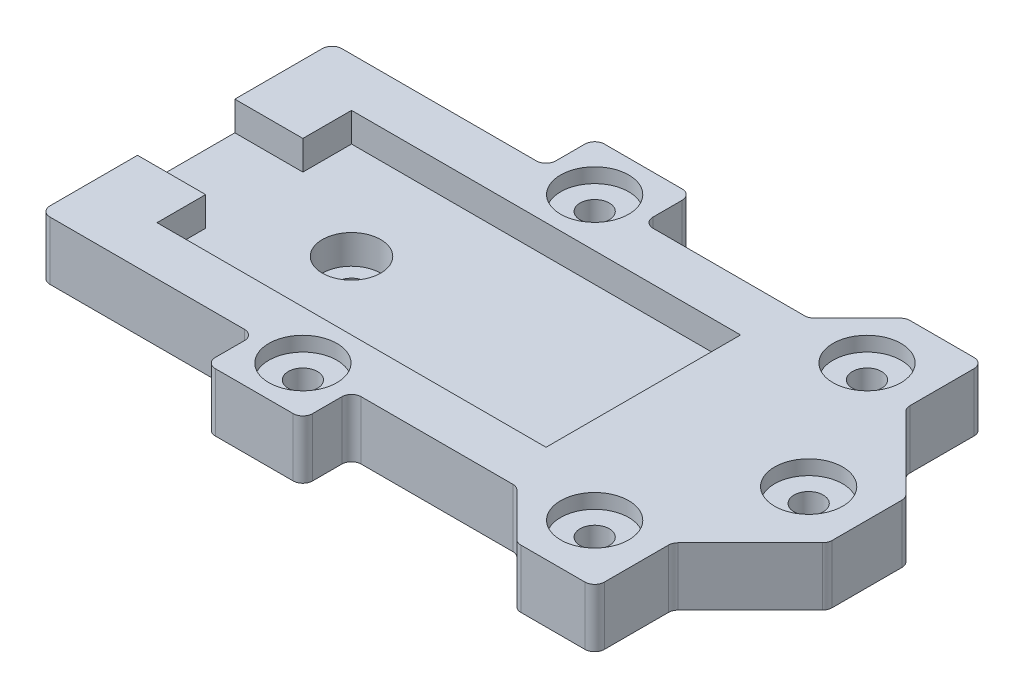
from build123d import *

# Parameters (mm, degrees)
SKETCH_1_R          = 1.5
EXTRUDE_1_DEPTH     = 6
CUT_EXTRUDE_1_DEPTH = 3
SKETCH_3_R          = 3.5
CUT_EXTRUDE_2_DEPTH = 1.5
SKETCH_5_R          = 3
CUT_EXTRUDE_3_DEPTH = 3
SKETCH_6_R          = 6
EXTRUDE_2_DEPTH     = 3.5
CUT_EXTRUDE_START   = -1
SKETCH_7_R          = 3
CUT_EXTRUDE_4_DEPTH = 1
SKETCH_8_R          = 1.5
CUT_EXTRUDE_5_DEPTH = 49.179352424
FILLET_1_R          = 1


with BuildPart() as part:
    # 草图1 → 凸台-拉伸1 (new body)
    with BuildSketch(Plane(origin=(0, 0, 0), x_dir=(1, 0, 0), z_dir=(0, 1, 0))):
        Polygon((-27, 15), (-27, -15), (-5, -15), (-5, -20), (5, -20), (5, -15), (22, -15), (27, -20), (35, -20), (35, -12), (43, -4), (43, 4), (35, 12), (35, 20), (27, 20), (22, 15), (5, 15), (5, 20), (-5, 20), (-5, 15), align=None)
        with Locations((0, 15)):
            Circle(SKETCH_1_R, mode=Mode.SUBTRACT)
        with Locations((0, -15)):
            Circle(SKETCH_1_R, mode=Mode.SUBTRACT)
        with Locations((29, -14)):
            Circle(SKETCH_1_R, mode=Mode.SUBTRACT)
        with Locations((37, 0)):
            Circle(SKETCH_1_R, mode=Mode.SUBTRACT)
        with Locations((29, 14)):
            Circle(SKETCH_1_R, mode=Mode.SUBTRACT)
    extrude(amount=EXTRUDE_1_DEPTH)

    # 草图2 → 切除-拉伸1 (cut)
    with BuildSketch(Plane(origin=(0, 6, 0), x_dir=(1, 0, 0), z_dir=(0, 1, 0))):
        Polygon((20, 10), (-20, 10), (-20, 5), (-27, 5), (-27, -5), (-20, -5), (-20, -10), (20, -10), align=None)
    extrude(amount=-CUT_EXTRUDE_1_DEPTH, mode=Mode.SUBTRACT)

    # 草图3 → 切除-拉伸2 (cut)
    with BuildSketch(Plane(origin=(0, 6, 0), x_dir=(1, 0, 0), z_dir=(0, 1, 0))):
        with Locations((0, 15)):
            Circle(SKETCH_3_R)
        with Locations((0, -15)):
            Circle(SKETCH_3_R)
        with Locations((29, -14)):
            Circle(SKETCH_3_R)
        with Locations((37, 0)):
            Circle(SKETCH_3_R)
        with Locations((29, 14)):
            Circle(SKETCH_3_R)
    extrude(amount=-CUT_EXTRUDE_2_DEPTH, mode=Mode.SUBTRACT)

    # 草图5 → 切除-拉伸3 (cut)
    with BuildSketch(Plane(origin=(0, 3, 0), x_dir=(1, 0, 0), z_dir=(0, 1, 0))):
        with Locations((-10, 0)):
            Circle(SKETCH_5_R)
    extrude(amount=-CUT_EXTRUDE_3_DEPTH, mode=Mode.SUBTRACT)

    # 草图6 → 凸台-拉伸2 (add)
    with BuildSketch(Plane.XZ):
        with Locations((-10, 0)):
            Circle(SKETCH_6_R)
    extrude(amount=EXTRUDE_2_DEPTH)

    # 草图7 → 切除-拉伸4 (cut)
    with BuildSketch(Plane.XZ.offset(3.5).offset(CUT_EXTRUDE_START)):
        with Locations((-10, 0)):
            Circle(SKETCH_7_R)
    extrude(amount=CUT_EXTRUDE_4_DEPTH, mode=Mode.SUBTRACT)

    # 草图8 → 切除-拉伸5 (cut, through all)
    with BuildSketch(Plane.XZ.offset(2.5)):
        with Locations((-10, 0)):
            Circle(SKETCH_8_R)
    extrude(amount=-CUT_EXTRUDE_5_DEPTH, mode=Mode.SUBTRACT)

    # 圆角1
    fillet_1_edges = [part.edges().sort_by_distance(p)[0] for p in [
        (27, 3, 20),
        (22, 3, 15),
        (5, 3, 15),
        (5, 3, 20),
        (-5, 3, 20),
        (-5, 3, 15),
        (-27, 3, 15),
        (-27, 3, -15),
        (-5, 3, -15),
        (27, 3, -20),
        (-5, 3, -20),
        (5, 3, -20),
        (5, 3, -15),
        (22, 3, -15),
        (35, 3, -20),
        (35, 3, -12),
        (43, 3, -4),
        (43, 3, 4),
        (35, 3, 12),
        (35, 3, 20),
    ]]
    fillet(fillet_1_edges, radius=FILLET_1_R)


solid = part.part
